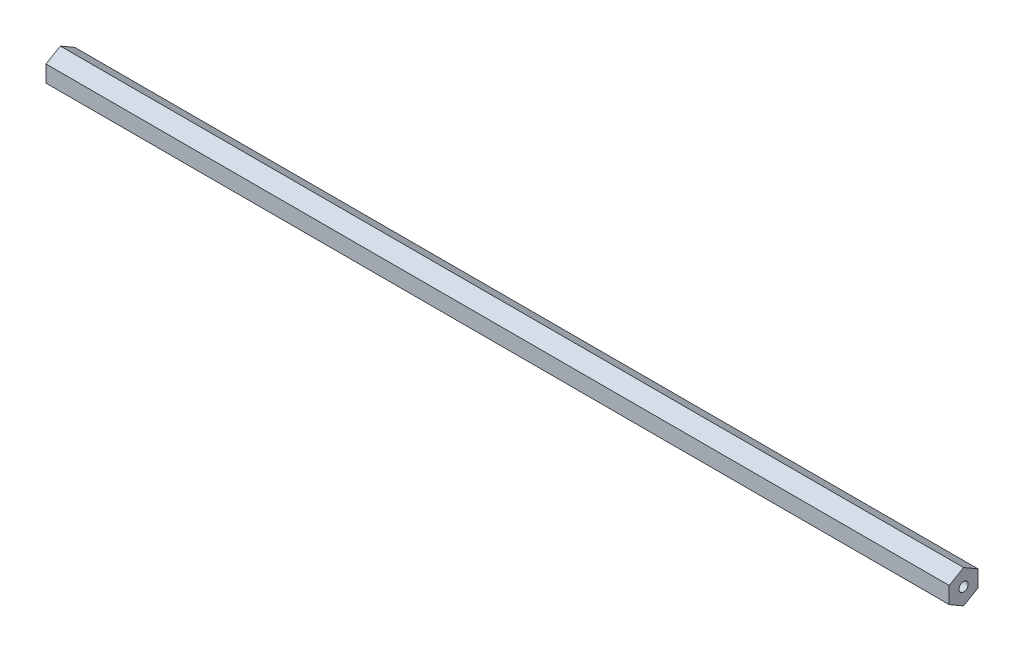
from build123d import *

# Parameters (mm, degrees)
BOSS_EXTRUDE1_DEPTH                  = 199.263
F_10_32_TAPPED_HOLE1_D               = 4.0386
F_10_32_TAPPED_HOLE1_DEPTH           = 16.34744
F_10_32_TAPPED_HOLE1_TIP             = 1.213317848
F_10_32_TAPPED_HOLE1_ON_FACE_2_D     = 4.0386
F_10_32_TAPPED_HOLE1_ON_FACE_2_DEPTH = 16.34744
F_10_32_TAPPED_HOLE1_ON_FACE_2_TIP   = 1.213317848


with BuildPart() as part:
    # Sketch1 → Boss-Extrude1 (new, symmetric)
    with BuildSketch(Plane(origin=(0, 0, 0), x_dir=(0, 0, -1), z_dir=(1, 0, 0))):
        Polygon((6.35, 3.666174209), (0, 7.332348419), (-6.35, 3.666174209), (-6.35, -3.666174209), (0, -7.332348419), (6.35, -3.666174209), align=None)
    extrude(amount=BOSS_EXTRUDE1_DEPTH, both=True)

    # #10-32 Tapped Hole1
    with Locations(Plane(origin=(199.263, 0, 0), x_dir=(0, 0, 1), z_dir=(1, 0, 0))):
        with Locations((0, 0)):
            Hole(F_10_32_TAPPED_HOLE1_D / 2, depth=F_10_32_TAPPED_HOLE1_DEPTH)
            with Locations((0, 0, -(F_10_32_TAPPED_HOLE1_DEPTH + F_10_32_TAPPED_HOLE1_TIP / 2))):  # 118° drill point
                Cone(0, F_10_32_TAPPED_HOLE1_D / 2, F_10_32_TAPPED_HOLE1_TIP, mode=Mode.SUBTRACT)

    # #10-32 Tapped Hole1 on face 2
    with Locations(Plane(origin=(-199.263, 0, 0), x_dir=(0, 0, -1), z_dir=(-1, 0, 0))):
        with Locations((0, 0)):
            Hole(F_10_32_TAPPED_HOLE1_ON_FACE_2_D / 2, depth=F_10_32_TAPPED_HOLE1_ON_FACE_2_DEPTH)
            with Locations((0, 0, -(F_10_32_TAPPED_HOLE1_ON_FACE_2_DEPTH + F_10_32_TAPPED_HOLE1_ON_FACE_2_TIP / 2))):  # 118° drill point
                Cone(0, F_10_32_TAPPED_HOLE1_ON_FACE_2_D / 2, F_10_32_TAPPED_HOLE1_ON_FACE_2_TIP, mode=Mode.SUBTRACT)


solid = part.part
